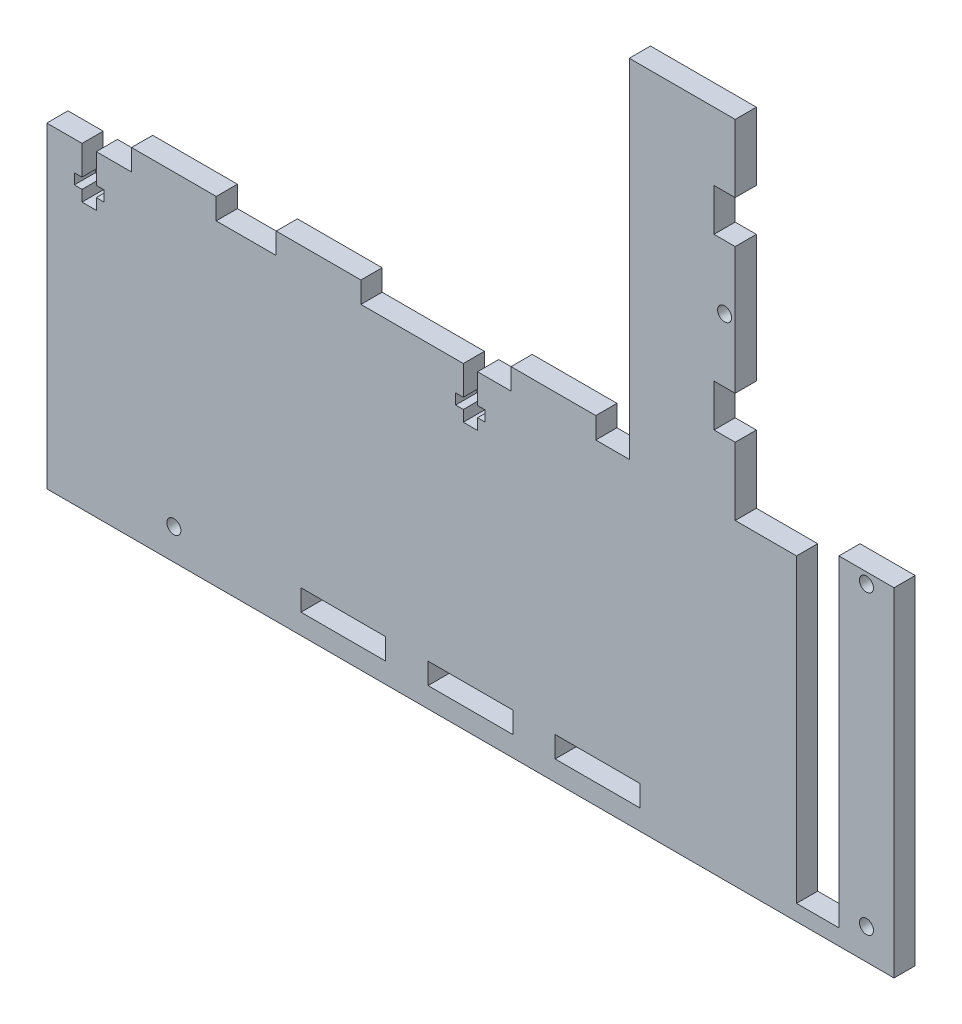
from build123d import *

# Parameters (mm, degrees)
SKETCH1_W                       = 254
SKETCH1_H                       = 6.35
BASE_EXTRUSION_DEPTH            = 94.968888282
SKETCH4_W                       = 25.4
SKETCH4_H                       = 6.35
TAB_HOLES_TO_CHASSIS_BASE_DEPTH = 173.608322449
T_SLOT_CENTER_DEPTH             = 173.608322449
SKETCH6_W                       = 31.75
SKETCH6_H                       = 104.14
ARM_SUPPORT_DEPTH               = 6.35
SKETCH8_W                       = 12.7
SKETCH8_H                       = 6.35
ARM_CLEARANCE_DEPTH             = 90.206388282
SKETCH9_R                       = 2.0955
BASE_MOUNTING_HOLE_1_DEPTH      = 246.802548054
SKETCH10_R                      = 2.0955
BASE_MOUNTING_HOLE_2_DEPTH      = 246.802548054
SKETCH11_R                      = 2.0955
ARM_SUPPORT_MOUNTING_HOLE_DEPTH = 246.802548054
SKETCH12_W                      = 6.35
SKETCH12_H                      = 12.7
ARM_SUPPORT_TAB_SLOTS_DEPTH     = 246.802548054
T_START                         = -6.35
T_SLOT_TOP_CORNER_DEPTH         = 6.35
T_SLOT_TOP_CORNER_2_OUTLINE_W   = 25.4
T_SLOT_TOP_CORNER_2_OUTLINE_H   = 6.35
T_SLOT_TOP_CORNER_2_OUTLINE_W_2 = 16.5312
T_SLOT_TOP_CORNER_2_DEPTH       = 6.35
SKETCH15_R                      = 2.0955
CUT_EXTRUDE8_DEPTH              = 246.802548054


# Read off the part's stored shape, not the designer's step: T Slot Top Corner
with BuildPart() as part:
    # Sketch1 → Base Extrusion (new body)
    with BuildSketch(Plane(origin=(0, 0, 0), x_dir=(1, 0, 0), z_dir=(0, 1, 0))):
        with Locations((-16.993821871, 0)):
            Rectangle(SKETCH1_W, SKETCH1_H)
    extrude(amount=BASE_EXTRUSION_DEPTH)

    # Sketch4 → Tab Holes to Chassis Base (cut, through all)
    with BuildSketch(Plane.XY.offset(3.175)):
        with Locations((-55.093821871, 9.243888282)):
            Rectangle(SKETCH4_W, SKETCH4_H)
        with Locations((-16.993821871, 9.243888282)):
            Rectangle(SKETCH4_W, SKETCH4_H)
        with Locations((21.106178129, 9.243888282)):
            Rectangle(SKETCH4_W, SKETCH4_H)
    extrude(amount=-TAB_HOLES_TO_CHASSIS_BASE_DEPTH, mode=Mode.SUBTRACT)

    # Sketch5 → T Slot Center (cut, through all)
    with BuildSketch(Plane.XY.offset(3.175)):
        Polygon((-14.860221871, 94.968888282), (-19.127421871, 94.968888282), (-19.127421871, 86.205888282), (-21.438821871, 86.205888282), (-21.438821871, 83.030888282), (-19.127421871, 83.030888282), (-19.127421871, 79.728888282), (-14.860221871, 79.728888282), (-14.860221871, 83.030888282), (-12.548821871, 83.030888282), (-12.548821871, 86.205888282), (-14.860221871, 86.205888282), align=None)
    extrude(amount=-T_SLOT_CENTER_DEPTH, mode=Mode.SUBTRACT)

    # Sketch6 → Arm Support (add)
    with BuildSketch(Plane.XY.offset(3.175)):
        with Locations((46.506178129, 147.038888282)):
            Rectangle(SKETCH6_W, SKETCH6_H)
    extrude(amount=-ARM_SUPPORT_DEPTH)

    # Sketch8 → Arm Clearance (cut)
    with BuildSketch(Plane(origin=(0, 94.968888282, 0), x_dir=(1, 0, 0), z_dir=(0, 1, 0))):
        with Locations((87.124978129, 0)):
            Rectangle(SKETCH8_W, SKETCH8_H)
    extrude(amount=-ARM_CLEARANCE_DEPTH, mode=Mode.SUBTRACT)

    # Sketch9 → Base Mounting Hole 1 (cut, through all)
    with BuildSketch(Plane.XY.offset(3.175)):
        with Locations((101.740578129, 9.243888282)):
            Circle(SKETCH9_R)
    extrude(amount=-BASE_MOUNTING_HOLE_1_DEPTH, mode=Mode.SUBTRACT)

    # Sketch10 → Base Mounting Hole 2 (cut, through all)
    with BuildSketch(Plane.XY.offset(3.175)):
        with Locations((-105.893821871, 9.243888282)):
            Circle(SKETCH10_R)
    extrude(amount=-BASE_MOUNTING_HOLE_2_DEPTH, mode=Mode.SUBTRACT)

    # Sketch11 → Arm Support Mounting Hole (cut, through all)
    with BuildSketch(Plane.XY.offset(3.175)):
        with Locations((59.206178129, 147.038888282)):
            Circle(SKETCH11_R)
    extrude(amount=-ARM_SUPPORT_MOUNTING_HOLE_DEPTH, mode=Mode.SUBTRACT)

    # Sketch12 → Arm Support Tab Slots (cut, through all)
    with BuildSketch(Plane.XY.offset(3.175)):
        with Locations((59.206178129, 172.438888282)):
            Rectangle(SKETCH12_W, SKETCH12_H)
        with Locations((59.206178129, 121.638888282)):
            Rectangle(SKETCH12_W, SKETCH12_H)
    extrude(amount=-ARM_SUPPORT_TAB_SLOTS_DEPTH, mode=Mode.SUBTRACT)

    # T Slot Top Corner outline → T Slot Top Corner (cut)
    with BuildSketch(Plane.XY.offset(3.175).offset(T_START)):
        Polygon((-126.848821871, 83.030888282), (-126.848821871, 86.205888282), (-129.160221871, 86.205888282), (-129.160221871, 94.968888282), (-133.427421871, 94.968888282), (-133.427421871, 86.205888282), (-135.738821871, 86.205888282), (-135.738821871, 83.030888282), (-133.427421871, 83.030888282), (-133.427421871, 79.728888282), (-129.160221871, 79.728888282), (-129.160221871, 83.030888282), align=None)
    extrude(amount=T_SLOT_TOP_CORNER_DEPTH, mode=Mode.SUBTRACT)

    # T Slot Top Corner 2 outline → T Slot Top Corner 2 (add)
    with BuildSketch(Plane.XY.offset(3.175).offset(T_START)):
        with Locations((-62.510621871, 98.143888282)):
            Rectangle(T_SLOT_TOP_CORNER_2_OUTLINE_W, T_SLOT_TOP_CORNER_2_OUTLINE_H)
        with Locations((-105.893821871, 98.143888282)):
            Rectangle(T_SLOT_TOP_CORNER_2_OUTLINE_W, T_SLOT_TOP_CORNER_2_OUTLINE_H)
        with Locations((101.740578129, 98.143888282)):
            Rectangle(T_SLOT_TOP_CORNER_2_OUTLINE_W_2, T_SLOT_TOP_CORNER_2_OUTLINE_H)
        with Locations((7.885478129, 98.143888282)):
            Rectangle(T_SLOT_TOP_CORNER_2_OUTLINE_W, T_SLOT_TOP_CORNER_2_OUTLINE_H)
    extrude(amount=T_SLOT_TOP_CORNER_2_DEPTH)

    # Sketch15 → Cut-Extrude8 (cut, through all)
    with BuildSketch(Plane.XY.offset(3.175)):
        with Locations((101.740578129, 98.143888282)):
            Circle(SKETCH15_R)
    extrude(amount=-CUT_EXTRUDE8_DEPTH, mode=Mode.SUBTRACT)


solid = part.part
